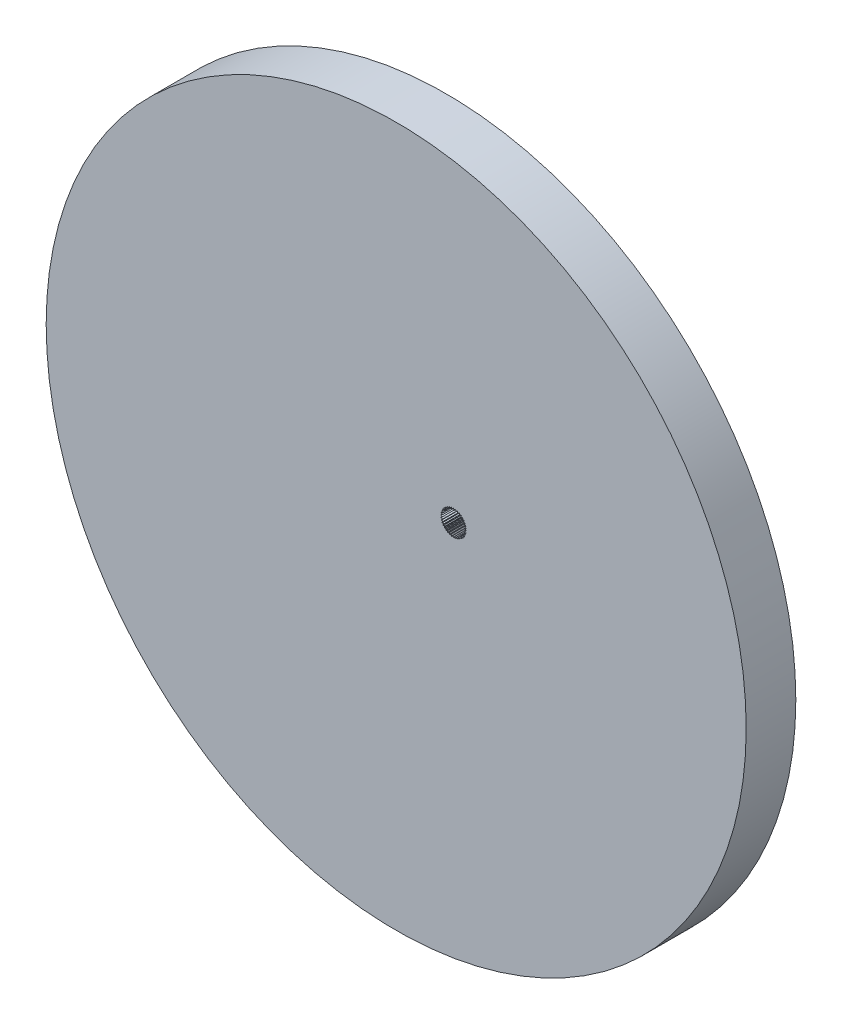
from build123d import *

# Parameters (mm, degrees)
SKETCH1_R           = 70.548036847
BOSS_EXTRUDE1_DEPTH = 10
CUT_EXTRUDE4_DEPTH  = 10


with BuildPart() as part:
    # Sketch1 → Boss-Extrude1 (new body)
    with BuildSketch(Plane.XY):
        Circle(SKETCH1_R)
    extrude(amount=BOSS_EXTRUDE1_DEPTH)

    # Sketch4 → Cut-Extrude4 (cut)
    with BuildSketch(Plane.XY.offset(10)):
        with BuildLine():
            Line((9.127956815, 5.633299661), (9.459541206, 5.590983238))
            Line((9.459541206, 5.590983238), (9.229545605, 5.360987637))
            ThreePointArc((9.229545605, 5.360987637), (9.256631551, 5.301444117), (9.285235917, 5.242614963))
            Line((9.285235918, 5.242614963), (9.619262985, 5.255452678))
            Line((9.619262985, 5.255452678), (9.430260255, 4.990737885))
            ThreePointArc((9.430260255, 4.990737885), (9.466777325, 4.936464662), (9.504674526, 4.883145985))
            Line((9.504674527, 4.883145986), (9.832032881, 4.950787659))
            Line((9.832032881, 4.950787659), (9.689178526, 4.658574404))
            ThreePointArc((9.689178525, 4.658574403), (9.734130628, 4.611051908), (9.780286927, 4.564698102))
            Line((9.780286928, 4.564698104), (10.092047088, 4.685298647))
            Line((10.092047088, 4.685298647), (9.9992378, 4.373557746))
            ThreePointArc((9.999237799, 4.373557744), (10.051398761, 4.334082267), (10.104555133, 4.295957744))
            Line((10.104555135, 4.295957747), (10.392213095, 4.466227491))
            Line((10.392213095, 4.466227491), (10.351980471, 4.143462423))
            ThreePointArc((10.35198047, 4.143462421), (10.409927474, 4.11311075), (10.468633953, 4.084255447))
            Line((10.468633954, 4.08425545), (10.724343156, 4.299549882))
            Line((10.724343156, 4.299549882), (10.737784637, 3.974564836))
            ThreePointArc((10.737784636, 3.974564833), (10.799937039, 3.954164883), (10.862592265, 3.935365897))
            Line((10.862592266, 3.935365901), (11.079377628, 4.189812348))
            Line((11.079377628, 4.189812348), (11.146126565, 3.87147207))
            ThreePointArc((11.146126565, 3.871472067), (11.210789012, 3.861580294), (11.275683913, 3.853350414))
            Line((11.275683914, 3.853350418), (11.447632098, 4.140008246))
            Line((11.447632098, 4.140008246), (11.565867754, 3.836996228))
            ThreePointArc((11.565867754, 3.836996224), (11.631276422, 3.837882452), (11.696640835, 3.840446166))
            Line((11.696640835, 3.84044617), (11.819061542, 4.1514961))
            Line((11.819061542, 4.1514961), (11.985558757, 3.87207772))
            ThreePointArc((11.985558758, 3.872077716), (12.049929468, 3.88371777), (12.113980423, 3.897005147))
            Line((12.113980422, 3.897005151), (12.183534335, 4.223962551))
            Line((12.183534335, 4.223962551), (12.393751498, 3.975759615))
            ThreePointArc((12.3937515, 3.975759611), (12.455328387, 3.99783598), (12.51631874, 4.021484576))
            Line((12.516318738, 4.02148458), (12.531108607, 4.355430905))
            Line((12.531108607, 4.355430905), (12.779311543, 4.145213741))
            ThreePointArc((12.779311545, 4.145213738), (12.836414954, 4.177124237), (12.892681047, 4.210488978))
            Line((12.892681044, 4.210488982), (12.85230344, 4.542315047))
            Line((12.85230344, 4.542315047), (13.13172182, 4.375817832))
            ThreePointArc((13.131721822, 4.375817829), (13.182794119, 4.416692022), (13.232801159, 4.458862807))
            Line((13.232801157, 4.45886281), (13.138357475, 4.779517264))
            Line((13.138357475, 4.779517264), (13.441369493, 4.661281608))
            ThreePointArc((13.441369495, 4.661281605), (13.485017562, 4.710004552), (13.527401488, 4.75983107))
            Line((13.527401486, 4.759831073), (13.381467904, 5.060567299))
            Line((13.381467904, 5.060567299), (13.699808183, 4.993818362))
            ThreePointArc((13.699808185, 4.99381836), (13.734841415, 5.049061025), (13.768446105, 5.10518414))
            Line((13.768446102, 5.105184141), (13.575003309, 5.37779884))
            Line((13.575003309, 5.37779884), (13.899988354, 5.364357359))
            ThreePointArc((13.899988357, 5.364357358), (13.925451135, 5.424612864), (13.94935994, 5.485501683))
            Line((13.949359937, 5.485501684), (13.713684547, 5.722558636))
            Line((13.713684547, 5.722558636), (14.036449615, 5.76279126))
            ThreePointArc((14.036449617, 5.762791259), (14.051647386, 5.826415995), (14.065208136, 5.890409629))
            Line((14.065208134, 5.89040963), (13.793728757, 6.08544254))
            Line((13.793728757, 6.08544254), (14.105469658, 6.178251827))
            ThreePointArc((14.105469659, 6.178251827), (14.109987863, 6.243510275), (14.112830656, 6.308863145))
            Line((14.112830654, 6.308863145), (13.81295254, 6.456552024))
            Line((13.81295254, 6.456552024), (14.105165795, 6.599406379))
            ThreePointArc((14.105165796, 6.599406379), (14.09888119, 6.664518459), (14.090928481, 6.72944791))
            Line((14.09092848, 6.72944791), (13.770831523, 6.825764189))
            Line((13.770831523, 6.825764189), (14.035546316, 7.014766918))
            ThreePointArc((14.035546315, 7.014766918), (14.018630327, 7.077956542), (14.000099047, 7.140691467))
            Line((14.000099047, 7.140691467), (13.668514656, 7.18300789))
            Line((13.668514656, 7.18300789), (13.898510257, 7.413003491))
            ThreePointArc((13.898510256, 7.413003491), (13.87142431, 7.47254701), (13.842819943, 7.531376164))
            Line((13.842819944, 7.531376164), (13.508792877, 7.518538449))
            Line((13.508792877, 7.518538449), (13.697795607, 7.783253242))
            ThreePointArc((13.697795605, 7.783253241), (13.661278535, 7.837526464), (13.623381334, 7.890845141))
            Line((13.623381335, 7.890845142), (13.296022981, 7.823203469))
            Line((13.296022981, 7.823203469), (13.438877336, 8.115416724))
            ThreePointArc((13.438877335, 8.115416722), (13.393925231, 8.162939217), (13.347768932, 8.209293022))
            Line((13.347768933, 8.209293024), (13.036008774, 8.08869248))
            Line((13.036008774, 8.08869248), (13.128818062, 8.400433382))
            ThreePointArc((13.12881806, 8.400433379), (13.076657098, 8.439908856), (13.023500726, 8.478033379))
            Line((13.023500727, 8.478033381), (12.735842767, 8.307763636))
            Line((12.735842767, 8.307763636), (12.776075391, 8.630528705))
            ThreePointArc((12.776075389, 8.630528701), (12.718128385, 8.660880372), (12.659421906, 8.689735675))
            Line((12.659421908, 8.689735678), (12.403712706, 8.474441246))
            Line((12.403712706, 8.474441246), (12.390271225, 8.799426292))
            ThreePointArc((12.390271224, 8.799426288), (12.328118821, 8.819826238), (12.265463595, 8.838625223))
            Line((12.265463596, 8.838625227), (12.048678233, 8.584178779))
            Line((12.048678233, 8.584178779), (11.981929297, 8.902519058))
            ThreePointArc((11.981929296, 8.902519053), (11.917266849, 8.912410825), (11.852371948, 8.920640705))
            Line((11.852371948, 8.920640709), (11.680423764, 8.633982882))
            Line((11.680423764, 8.633982882), (11.562188108, 8.9369949))
            ThreePointArc((11.562188108, 8.936994895), (11.49677944, 8.936108667), (11.431415027, 8.933544953))
            Line((11.431415027, 8.933544957), (11.308994319, 8.622495028))
            Line((11.308994319, 8.622495028), (11.142497105, 8.901913408))
            ThreePointArc((11.142497105, 8.901913403), (11.078126395, 8.890273349), (11.014075441, 8.876985972))
            Line((11.01407544, 8.876985976), (10.944521527, 8.550028576))
            Line((10.944521527, 8.550028576), (10.734304364, 8.798231513))
            ThreePointArc((10.734304365, 8.798231508), (10.672727478, 8.776155139), (10.611737125, 8.752506543))
            Line((10.611737123, 8.752506548), (10.596947255, 8.418560223))
            Line((10.596947255, 8.418560223), (10.348744319, 8.628777386))
            ThreePointArc((10.348744321, 8.628777382), (10.291640913, 8.596866884), (10.23537482, 8.563502142))
            Line((10.235374818, 8.563502146), (10.275752422, 8.231676081))
            Line((10.275752422, 8.231676081), (9.996334042, 8.398173296))
            ThreePointArc((9.996334045, 8.398173292), (9.945261748, 8.357299099), (9.895254708, 8.315128315))
            Line((9.895254705, 8.315128318), (9.989698387, 7.994473863))
            Line((9.989698387, 7.994473863), (9.686686369, 8.11270952))
            ThreePointArc((9.686686372, 8.112709517), (9.643038306, 8.063986571), (9.600654379, 8.014160053))
            Line((9.600654376, 8.014160055), (9.746587958, 7.713423828))
            Line((9.746587958, 7.713423828), (9.428247679, 7.780172766))
            ThreePointArc((9.428247683, 7.780172763), (9.393214453, 7.724930099), (9.359609763, 7.668806985))
            Line((9.35960976, 7.668806986), (9.553052553, 7.396192288))
            Line((9.553052553, 7.396192288), (9.228067507, 7.409633769))
            ThreePointArc((9.228067511, 7.409633768), (9.202604732, 7.349378261), (9.178695927, 7.288489443))
            Line((9.178695925, 7.288489444), (9.414371315, 7.051432492))
            Line((9.414371315, 7.051432492), (9.091606247, 7.011199868))
            ThreePointArc((9.091606249, 7.011199867), (9.07640848, 6.947575132), (9.06284773, 6.883581497))
            Line((9.062847728, 6.883581498), (9.334327105, 6.688548588))
            Line((9.334327105, 6.688548588), (9.022586204, 6.595739301))
            ThreePointArc((9.022586206, 6.595739301), (9.018068002, 6.530480853), (9.015225209, 6.465127982))
            Line((9.015225208, 6.465127982), (9.315103322, 6.317439104))
            Line((9.315103322, 6.317439104), (9.022890067, 6.174584748))
            ThreePointArc((9.022890068, 6.174584749), (9.029174674, 6.109472669), (9.037127382, 6.044543218))
            Line((9.037127381, 6.044543218), (9.357224339, 5.948226939))
            Line((9.357224339, 5.948226939), (9.092509546, 5.75922421))
            ThreePointArc((9.092509547, 5.75922421), (9.109425535, 5.696034586), (9.127956815, 5.633299661))
        make_face()
    extrude(amount=-CUT_EXTRUDE4_DEPTH, mode=Mode.SUBTRACT)


solid = part.part
